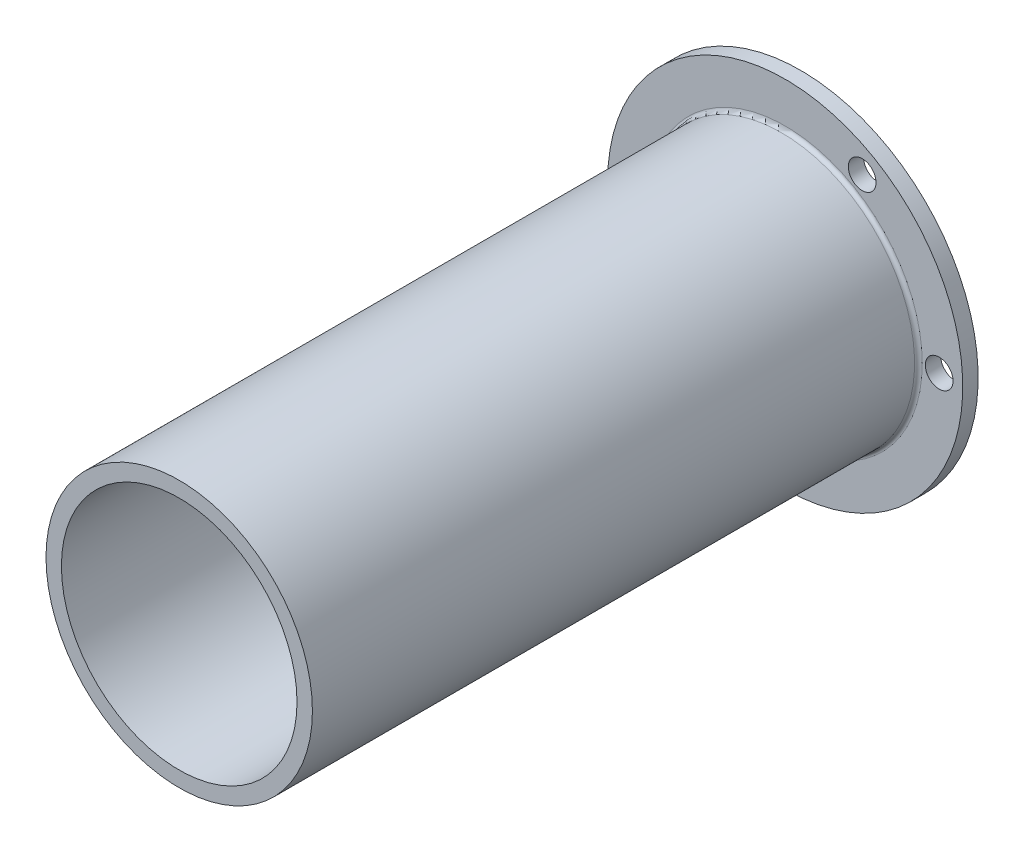
from build123d import *
from build123d.topology import SkipClean

# Parameters (mm, degrees)
SKETCH1_R           = 8.65
SKETCH1_R_2         = 7.65
BOSS_EXTRUDE1_DEPTH = 39.35
BOSS_EXTRUDE2_START = 1
SKETCH2_R           = 11.53
SKETCH2_R_2         = 7.65
BOSS_EXTRUDE2_DEPTH = 1
CIRPATTERN1_COUNT   = 6
FILLET1_R           = 0.25


with BuildPart() as part:
    # Sketch1 → Boss-Extrude1 (new body)
    with BuildSketch(Plane.XY):
        Circle(SKETCH1_R)
        Circle(SKETCH1_R_2, mode=Mode.SUBTRACT)
    extrude(amount=BOSS_EXTRUDE1_DEPTH)

    # Sketch2 → Boss-Extrude2 (add)
    with SkipClean():  # the faces are left unmerged after this step: merging them gives an invalid solid
        with BuildSketch(Plane(origin=(0, 0, 0), x_dir=(-1, 0, 0), z_dir=(0, 0, -1)).offset(BOSS_EXTRUDE2_START)):
            Circle(SKETCH2_R)
            Circle(SKETCH2_R_2, mode=Mode.SUBTRACT)
        extrude(amount=-BOSS_EXTRUDE2_DEPTH)

    # Sketch11 → M1.6 Clearance Hole1 (revolve, cut)
    with SkipClean():  # the faces are left unmerged after this step: merging them gives an invalid solid
        with BuildSketch(Plane(origin=(-10, 0, 0), x_dir=(0, -1, 0), z_dir=(1, 0, 0))):
            Polygon((0, 0), (0, 5.540774557), (0.9, 5), (0.9, 0), align=None)
        m1_6_clearance_hole1 = revolve(axis=Axis((-10, 0, 6.35), (0, 0, -1)), mode=Mode.SUBTRACT)

    # CirPattern1: M1.6 Clearance Hole1 ×6 about axis, 2 skipped
    with SkipClean():  # the faces are left unmerged after this step: merging them gives an invalid solid
        cirpattern1_axis = Axis((0, 0, 0), (0, 0, -1))
        add([m1_6_clearance_hole1.rotate(cirpattern1_axis, i * 360 / CIRPATTERN1_COUNT) for i in range(1, CIRPATTERN1_COUNT) if i not in (1, 4)], mode=Mode.SUBTRACT)

    # Fillet1
    fillet1_edges = [part.edges().sort_by_distance(p)[0] for p in [
        (-8.65, 0, 0),
    ]]
    fillet(fillet1_edges, radius=FILLET1_R)


solid = part.part
